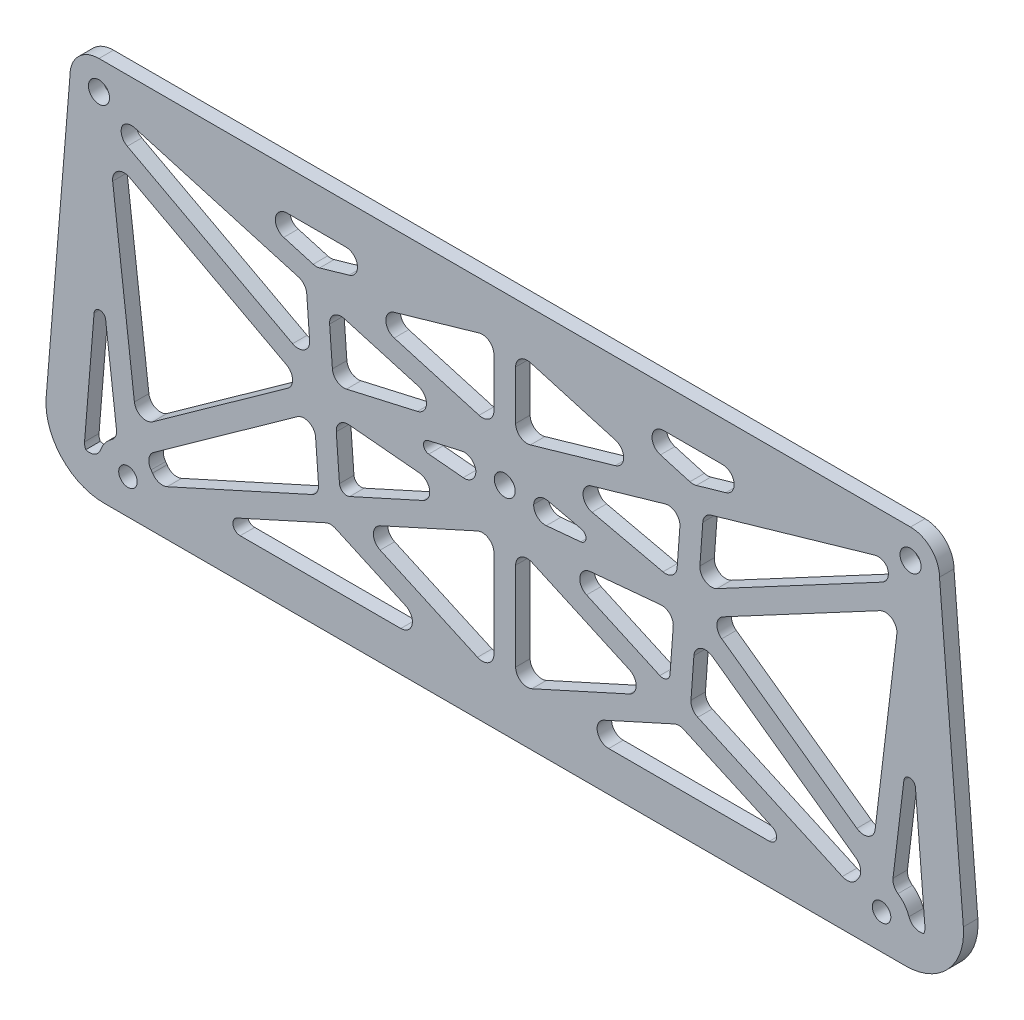
from build123d import *

# Parameters (mm, degrees)
SKETCH1_R              = 2.286
SKETCH1_R_2            = 2.3114
SKETCH1_R_3            = 2.032
BOSS_EXTRUDE1_DEPTH    = 3.175
FILLET1_R              = 12.7
CUT_EXTRUDE2_REACH     = 144.71
FILLET3_R              = 1.27
FILLET3_R_2            = 2.54
FILLET3_R_3            = 1.5875
FILLET3_OF_MIRROR1_R   = 1.27
FILLET3_OF_MIRROR1_R_2 = 2.54
FILLET3_OF_MIRROR1_R_3 = 1.5875


with BuildPart() as part:
    # Sketch1 → Boss-Extrude1 (new body)
    with BuildSketch(Plane.XY):
        with BuildLine():
            Line((-87.251790909, 0.809045632), (115.948209091, 0.809045632))
            Line((115.948209091, 0.809045632), (109.598209091, 78.279045632))
            ThreePointArc((109.598209091, 78.279045632), (107.738337152, 82.769173692), (103.248209091, 84.629045632))
            Line((103.248209091, 84.629045632), (-74.551790909, 84.629045632))
            ThreePointArc((-74.551790909, 84.629045632), (-79.041918969, 82.769173692), (-80.901790909, 78.279045632))
            Line((-80.901790909, 78.279045632), (-87.251790909, 0.809045632))
        make_face()
        with Locations((14.348209091, 48.116545632)):
            Circle(SKETCH1_R, mode=Mode.SUBTRACT)
        with Locations((-74.551790909, 78.279045632)):
            Circle(SKETCH1_R_2, mode=Mode.SUBTRACT)
        with Locations((103.248209091, 78.279045632)):
            Circle(SKETCH1_R_2, mode=Mode.SUBTRACT)
        with Locations((96.898209091, 8.429045632)):
            Circle(SKETCH1_R_3, mode=Mode.SUBTRACT)
        with Locations((-68.201790909, 8.455715632)):
            Circle(SKETCH1_R_3, mode=Mode.SUBTRACT)
    extrude(amount=BOSS_EXTRUDE1_DEPTH)

    # Fillet1
    fillet1_edges = [part.edges().sort_by_distance(p)[0] for p in [
        (115.948209091, 0.809045632, 1.5875),
        (-87.251790909, 0.809045632, 1.5875),
    ]]
    fillet(fillet1_edges, radius=FILLET1_R)

    # Sketch5 → Cut-Extrude2 (cut, up to next)
    with BuildSketch(Plane.XY.offset(3.175), mode=Mode.PRIVATE) as cut_extrude2_sk1:
        Polygon((-66.28077979, 19.080513036), (-29.871612483, 45.123700543), (-72.138211643, 67.69608706), align=None)
    cut_extrude2_tool1 = extrude(cut_extrude2_sk1.sketch, amount=-CUT_EXTRUDE2_REACH, mode=Mode.PRIVATE) & part.part
    # Sketch5 → Cut-Extrude2 (cut, up to next)
    with BuildSketch(Plane.XY.offset(3.175), mode=Mode.PRIVATE) as cut_extrude2_sk2:
        with BuildLine():
            ThreePointArc((-65.157616813, 14.028462178), (-63.107706759, 12.246864096), (-61.98966106, 9.771748589))
            Line((-61.98966106, 9.771748589), (-26.31599147, 25.945141322))
            Line((-26.31599147, 25.945141322), (-27.429755729, 41.014900846))
            Line((-27.429755729, 41.014900846), (-65.157616813, 14.028462178))
        make_face()
    cut_extrude2_tool2 = extrude(cut_extrude2_sk2.sketch, amount=-CUT_EXTRUDE2_REACH, mode=Mode.PRIVATE) & part.part
    # Sketch5 → Cut-Extrude2 (cut, up to next)
    with BuildSketch(Plane.XY.offset(3.175), mode=Mode.PRIVATE) as cut_extrude2_sk3:
        Polygon((-21.695328384, 28.040014084), (5.168325584, 40.219204811), (-22.785394449, 42.78912579), align=None)
    cut_extrude2_tool3 = extrude(cut_extrude2_sk3.sketch, amount=-CUT_EXTRUDE2_REACH, mode=Mode.PRIVATE) & part.part
    # Sketch5 → Cut-Extrude2 (cut, up to next)
    with BuildSketch(Plane.XY.offset(3.175), mode=Mode.PRIVATE) as cut_extrude2_sk4:
        with BuildLine():
            Line((-29.16875322, 64.544363036), (-68.630737441, 75.930565083))
            ThreePointArc((-68.630737441, 75.930565083), (-69.762627421, 74.085009525), (-71.448753582, 72.726985662))
            Line((-71.448753582, 72.726985662), (-28.06099333, 49.555845472))
            Line((-28.06099333, 49.555845472), (-29.16875322, 64.544363036))
        make_face()
    cut_extrude2_tool4 = extrude(cut_extrude2_sk4.sketch, amount=-CUT_EXTRUDE2_REACH, mode=Mode.PRIVATE) & part.part
    # Sketch5 → Cut-Extrude2 (cut, up to next)
    with BuildSketch(Plane.XY.offset(3.175), mode=Mode.PRIVATE) as cut_extrude2_sk5:
        Polygon((-23.196725961, 48.354636552), (4.818951722, 54.737687493), (-24.289208089, 63.13643873), align=None)
    cut_extrude2_tool5 = extrude(cut_extrude2_sk5.sketch, amount=-CUT_EXTRUDE2_REACH, mode=Mode.PRIVATE) & part.part
    # Sketch5 → Cut-Extrude2 (cut, up to next)
    with BuildSketch(Plane.XY.offset(3.175), mode=Mode.PRIVATE) as cut_extrude2_sk6:
        Polygon((11.966959091, 75.11357765), (-18.326601544, 66.372795632), (11.966959091, 57.632013613), align=None)
    cut_extrude2_tool6 = extrude(cut_extrude2_sk6.sketch, amount=-CUT_EXTRUDE2_REACH, mode=Mode.PRIVATE) & part.part
    # Sketch5 → Cut-Extrude2 (cut, up to next)
    with BuildSketch(Plane.XY.offset(3.175), mode=Mode.PRIVATE) as cut_extrude2_sk7:
        Polygon((-26.916142948, 68.851187325), (-2.494202721, 75.897795632), (-51.338083176, 75.897795632), align=None)
    cut_extrude2_tool7 = extrude(cut_extrude2_sk7.sketch, amount=-CUT_EXTRUDE2_REACH, mode=Mode.PRIVATE) & part.part
    # Sketch5 → Cut-Extrude2 (cut, up to next)
    with BuildSketch(Plane.XY.offset(3.175), mode=Mode.PRIVATE) as cut_extrude2_sk8:
        Polygon((11.966959091, 10.853182764), (-18.051778519, 24.462795632), (11.966959091, 38.0724085), align=None)
    cut_extrude2_tool8 = extrude(cut_extrude2_sk8.sketch, amount=-CUT_EXTRUDE2_REACH, mode=Mode.PRIVATE) & part.part
    # Sketch5 → Cut-Extrude2 (cut, up to next)
    with BuildSketch(Plane.XY.offset(3.175), mode=Mode.PRIVATE) as cut_extrude2_sk9:
        Polygon((3.328971218, 9.540295632), (-50.966352676, 9.540295632), (-23.818690729, 21.848247224), align=None)
    cut_extrude2_tool9 = extrude(cut_extrude2_sk9.sketch, amount=-CUT_EXTRUDE2_REACH, mode=Mode.PRIVATE) & part.part
    # Sketch5 → Cut-Extrude2 (cut, up to next)
    with BuildSketch(Plane.XY.offset(3.175), mode=Mode.PRIVATE) as cut_extrude2_sk10:
        with BuildLine():
            Line((-74.5984224, 48.301652359), (-77.828650702, 8.892867072))
            ThreePointArc((-77.828650702, 8.892867072), (-76.257166964, 7.804288888), (-74.432911183, 7.232751967))
            ThreePointArc((-74.432911183, 7.232751967), (-73.766936809, 11.513762576), (-70.510324917, 14.371218208))
            Line((-70.510324917, 14.371218208), (-74.5984224, 48.301652359))
        make_face()
    cut_extrude2_tool10 = extrude(cut_extrude2_sk10.sketch, amount=-CUT_EXTRUDE2_REACH, mode=Mode.PRIVATE) & part.part
    # Sketch5 → Cut-Extrude2 (cut, up to next)
    with BuildSketch(Plane.XY.offset(3.175), mode=Mode.PRIVATE) as cut_extrude2_sk11:
        with BuildLine():
            ThreePointArc((9.030021603, 44.646764393), (8.018160294, 47.613572252), (8.54880926, 50.702944982))
            Line((8.54880926, 50.702944982), (-10.251818791, 46.419437443))
            Line((-10.251818791, 46.419437443), (9.030021603, 44.646764393))
        make_face()
    cut_extrude2_tool11 = extrude(cut_extrude2_sk11.sketch, amount=-CUT_EXTRUDE2_REACH, mode=Mode.PRIVATE) & part.part
    cut_extrude2_1 = cut_extrude2_tool1.solids().sort_by_distance((-56.096868, 43.966767, 3.175))[0]
    add(cut_extrude2_1, mode=Mode.SUBTRACT)
    cut_extrude2_2 = cut_extrude2_tool2.solids().sort_by_distance((-42.444384, 24.422021, 3.175))[0]
    add(cut_extrude2_2, mode=Mode.SUBTRACT)
    cut_extrude2_3 = cut_extrude2_tool3.solids().sort_by_distance((-13.104132, 37.016115, 3.175))[0]
    add(cut_extrude2_3, mode=Mode.SUBTRACT)
    cut_extrude2_4 = cut_extrude2_tool4.solids().sort_by_distance((-45.564148, 64.027575, 3.175))[0]
    add(cut_extrude2_4, mode=Mode.SUBTRACT)
    cut_extrude2_5 = cut_extrude2_tool5.solids().sort_by_distance((-14.222327, 55.409588, 3.175))[0]
    add(cut_extrude2_5, mode=Mode.SUBTRACT)
    cut_extrude2_6 = cut_extrude2_tool6.solids().sort_by_distance((1.869106, 66.372796, 3.175))[0]
    add(cut_extrude2_6, mode=Mode.SUBTRACT)
    cut_extrude2_7 = cut_extrude2_tool7.solids().sort_by_distance((-26.916143, 73.548926, 3.175))[0]
    add(cut_extrude2_7, mode=Mode.SUBTRACT)
    cut_extrude2_8 = cut_extrude2_tool8.solids().sort_by_distance((1.960713, 24.462796, 3.175))[0]
    add(cut_extrude2_8, mode=Mode.SUBTRACT)
    cut_extrude2_9 = cut_extrude2_tool9.solids().sort_by_distance((-23.818691, 13.642946, 3.175))[0]
    add(cut_extrude2_9, mode=Mode.SUBTRACT)
    cut_extrude2_10 = cut_extrude2_tool10.solids().sort_by_distance((-74.391767, 23.038557, 3.175))[0]
    add(cut_extrude2_10, mode=Mode.SUBTRACT)
    cut_extrude2_11 = cut_extrude2_tool11.solids().sort_by_distance((2.092613, 47.233567, 3.175))[0]
    add(cut_extrude2_11, mode=Mode.SUBTRACT)
    cut_extrude2 = cut_extrude2_1 + cut_extrude2_2 + cut_extrude2_3 + cut_extrude2_4 + cut_extrude2_5 + cut_extrude2_6 + cut_extrude2_7 + cut_extrude2_8 + cut_extrude2_9 + cut_extrude2_10 + cut_extrude2_11  # Cut-Extrude2 as one shape, for the pattern or mirror that repeats it

    # Fillet3
    # the kernel refuses this fillet: 2.54, 1.5875, 1.27 mm, written as the material it adds along each edge
    with BuildSketch(Plane(origin=(-74.5984224, 48.301652359, 3.175), x_dir=(0.11961957547538542, -0.9928198009523624, 0), z_dir=(0, 0, -1))) as fillet3_piece_1:
        with BuildLine():
            CenterArc((FILLET3_R * 9.88251703181, FILLET3_R), FILLET3_R, 101.556047555, 168.443952445)
            Line((FILLET3_R * 9.6821906165, FILLET3_R * 1.97972921123), (0, 0))
            Line((0, 0), (FILLET3_R * 9.88251703181, 0))
        make_face()
    extrude(amount=3.175)
    with BuildSketch(Plane(origin=(-10.251818791, 46.419437443, 3.175), x_dir=(0.9750134933938565, 0.2221456452418279, 0), z_dir=(0, 0, -1))) as fillet3_piece_2:
        with BuildLine():
            CenterArc((FILLET3_R * 6.28259209384, FILLET3_R), FILLET3_R, 108.087801658, 161.912198342)
            Line((FILLET3_R * 5.97211803722, FILLET3_R * 1.95058185348), (0, 0))
            Line((0, 0), (FILLET3_R * 6.28259209384, 0))
        make_face()
    extrude(amount=3.175)
    with BuildSketch(Plane(origin=(-2.494202721, 75.897795632, 3.175), x_dir=(-1, 0, 0), z_dir=(0, 0, -1))) as fillet3_piece_3:
        with BuildLine():
            CenterArc((FILLET3_R_2 * 7.07292884489, -FILLET3_R_2), FILLET3_R_2, 90, 163.905246513)
            Line((FILLET3_R_2 * 6.79570217026, -FILLET3_R_2 * 1.96080454353), (0, 0))
            Line((0, 0), (FILLET3_R_2 * 7.07292884489, 0))
        make_face()
    extrude(amount=3.175)
    with BuildSketch(Plane(origin=(-51.338083176, 75.897795632, 3.175), x_dir=(1, 0, 0), z_dir=(0, 0, -1))) as fillet3_piece_4:
        with BuildLine():
            CenterArc((FILLET3_R_2 * 7.07292884489, FILLET3_R_2), FILLET3_R_2, 106.094753487, 163.905246513)
            Line((FILLET3_R_2 * 6.79570217026, FILLET3_R_2 * 1.96080454353), (0, 0))
            Line((0, 0), (FILLET3_R_2 * 7.07292884489, 0))
        make_face()
    extrude(amount=3.175)
    with BuildSketch(Plane(origin=(8.54880926, 50.702944982, 3.175), x_dir=(-0.9750134933938565, -0.22214564524182795, 0), z_dir=(0, 0, -1))) as fillet3_piece_5:
        with BuildLine():
            CenterArc((3.718869998, -2.54), FILLET3_R_2, 90, 98.213768649)
            ThreePointArc((1.204925503, -2.902881624), (0.784902966, -1.375713691), (0, 0))
            Line((0, 0), (3.718869998, 0))
        make_face()
    extrude(amount=3.175)
    with BuildSketch(Plane(origin=(9.030021603, 44.646764393, 3.175), x_dir=(-0.9958005933570363, 0.0915487753592294, 0), z_dir=(0, 0, -1))) as fillet3_piece_6:
        with BuildLine():
            CenterArc((3.80053912, 2.54), FILLET3_R_2, 170.925725398, 99.074274602)
            ThreePointArc((1.292327933, 2.940595362), (0.835167809, 1.387234588), (0, 0))
            Line((0, 0), (3.80053912, 0))
        make_face()
    extrude(amount=3.175)
    with BuildSketch(Plane(origin=(5.168325584, 40.219204811, 3.175), x_dir=(-0.9958005933570362, 0.09154877535923055, 0), z_dir=(0, 0, -1))) as fillet3_piece_7:
        with BuildLine():
            CenterArc((FILLET3_R_2 * 3.77939161606, -FILLET3_R_2), FILLET3_R_2, 90, 150.359144776)
            Line((FILLET3_R_2 * 3.28482987463, -FILLET3_R_2 * 1.8691424992), (0, 0))
            Line((0, 0), (FILLET3_R_2 * 3.77939161606, 0))
        make_face()
    extrude(amount=3.175)
    with BuildSketch(Plane(origin=(-22.785394449, 42.78912579, 3.175), x_dir=(0.9958005933570361, -0.09154877535923026, 0), z_dir=(0, 0, -1))) as fillet3_piece_8:
        with BuildLine():
            CenterArc((FILLET3_R_2 * 1.1808213888, FILLET3_R_2), FILLET3_R_2, 170.52039906, 99.47960094)
            Line((FILLET3_R_2 * 0.194477087751, FILLET3_R_2 * 1.1646964474), (0, 0))
            Line((0, 0), (FILLET3_R_2 * 1.1808213888, 0))
        make_face()
    extrude(amount=3.175)
    with BuildSketch(Plane(origin=(-24.289208089, 63.13643873, 3.175), x_dir=(0.9608045435341553, -0.2772266746258794, 0), z_dir=(0, 0, -1))) as fillet3_piece_9:
        with BuildLine():
            CenterArc((FILLET3_R_2 * 1.43671408313, FILLET3_R_2), FILLET3_R_2, 159.67835884, 110.32164116)
            Line((FILLET3_R_2 * 0.498956256307, FILLET3_R_2 * 1.34728987637), (0, 0))
            Line((0, 0), (FILLET3_R_2 * 1.43671408313, 0))
        make_face()
    extrude(amount=3.175)
    with BuildSketch(Plane(origin=(-68.630737441, 75.930565083, 3.175), x_dir=(0.9608045435341557, -0.2772266746258787, 0), z_dir=(0, 0, -1))) as fillet3_piece_10:
        with BuildLine():
            CenterArc((1.989519717, 2.54), FILLET3_R_2, 200.827301976, 69.172698024)
            ThreePointArc((-0.384507433, 1.636896967), (-0.137833822, 0.831231728), (0, 0))
            Line((0, 0), (1.989519717, 0))
        make_face()
    extrude(amount=3.175)
    with BuildSketch(Plane(origin=(-72.138211643, 67.69608706, 3.175), x_dir=(0.8820911004887111, -0.4710788579830499, 0), z_dir=(0, 0, -1))) as fillet3_piece_11:
        with BuildLine():
            CenterArc((FILLET3_R_2 * 1.91993879235, FILLET3_R_2), FILLET3_R_2, 145.025501931, 124.974498069)
            Line((FILLET3_R_2 * 1.10053153455, FILLET3_R_2 * 1.57321178099), (0, 0))
            Line((0, 0), (FILLET3_R_2 * 1.91993879235, 0))
        make_face()
    extrude(amount=3.175)
    with BuildSketch(Plane(origin=(-27.429755729, 41.014900846, 3.175), x_dir=(0.07370620720228421, -0.9972799983053175, 0), z_dir=(0, 0, -1))) as fillet3_piece_12:
        with BuildLine():
            CenterArc((FILLET3_R_2 * 1.78012041009, FILLET3_R_2), FILLET3_R_2, 148.651049013, 121.348950987)
            Line((FILLET3_R_2 * 0.926105745969, FILLET3_R_2 * 1.52024893413), (0, 0))
            Line((0, 0), (FILLET3_R_2 * 1.78012041009, 0))
        make_face()
    extrude(amount=3.175)
    with BuildSketch(Plane(origin=(-29.16875322, 64.544363036, 3.175), x_dir=(0.07370620720228492, -0.9972799983053174, 0), z_dir=(0, 0, -1))) as fillet3_piece_13:
        with BuildLine():
            CenterArc((FILLET3_R_2 * 0.696032712243, FILLET3_R_2), FILLET3_R_2, 200.32164116, 69.67835884)
            Line((-FILLET3_R_2 * 0.241725114583, FILLET3_R_2 * 0.652710123632), (0, 0))
            Line((0, 0), (FILLET3_R_2 * 0.696032712243, 0))
        make_face()
    extrude(amount=3.175)
    with BuildSketch(Plane(origin=(11.966959091, 75.11357765, 3.175), x_dir=(0, -1, 0), z_dir=(0, 0, -1)), Plane(origin=(11.966959091, 57.632013613, 3.175), x_dir=(-0.9608045435341552, 0.27722667462588046, 0), z_dir=(0, 0, -1))) as fillet3_piece_14:
        with BuildLine():
            CenterArc((FILLET3_R_2 * 1.32933038589, FILLET3_R_2), FILLET3_R_2, 163.905246513, 106.094753487)
            Line((FILLET3_R_2 * 0.368525842361, FILLET3_R_2 * 1.27722667463), (0, 0))
            Line((0, 0), (FILLET3_R_2 * 1.32933038589, 0))
        make_face()
    extrude(amount=3.175)
    with BuildSketch(Plane(origin=(11.966959091, 38.0724085, 3.175), x_dir=(0, -1, 0), z_dir=(0, 0, -1)), Plane(origin=(11.966959091, 10.853182764, 3.175), x_dir=(-0.910769138180063, 0.41291594415661065, 0), z_dir=(0, 0, -1))) as fillet3_piece_15:
        with BuildLine():
            CenterArc((FILLET3_R_2 * 1.55134367748, FILLET3_R_2), FILLET3_R_2, 155.611858043, 114.388141957)
            Line((FILLET3_R_2 * 0.640574539297, FILLET3_R_2 * 1.41291594416), (0, 0))
            Line((0, 0), (FILLET3_R_2 * 1.55134367748, 0))
        make_face()
    extrude(amount=3.175)
    with BuildSketch(Plane(origin=(-23.818690729, 21.848247224, 3.175), x_dir=(0.9107691381800633, -0.41291594415661004, 0), z_dir=(0, 0, -1))) as fillet3_piece_16:
        with BuildLine():
            CenterArc((FILLET3_R_2 * 0.453370592883, FILLET3_R_2), FILLET3_R_2, 221.223716087, 48.776283913)
            Line((-FILLET3_R_2 * 0.298771604317, FILLET3_R_2 * 0.340999153877), (0, 0))
            Line((0, 0), (FILLET3_R_2 * 0.453370592883, 0))
        make_face()
    extrude(amount=3.175)
    with BuildSketch(Plane(origin=(3.328971218, 9.540295632, 3.175), x_dir=(-1, 0, 0), z_dir=(0, 0, -1))) as fillet3_piece_17:
        with BuildLine():
            CenterArc((FILLET3_R_2 * 4.62750146905, FILLET3_R_2), FILLET3_R_2, 114.388141957, 155.611858043)
            Line((FILLET3_R_2 * 4.2145855249, FILLET3_R_2 * 1.91076913818), (0, 0))
            Line((0, 0), (FILLET3_R_2 * 4.62750146905, 0))
        make_face()
    extrude(amount=3.175)
    with BuildSketch(Plane(origin=(4.818951722, 54.737687493, 3.175), x_dir=(-0.9608045435341558, 0.27722667462587847, 0), z_dir=(0, 0, -1))) as fillet3_piece_18:
        with BuildLine():
            CenterArc((FILLET3_R_2 * 3.87650248104, -FILLET3_R_2), FILLET3_R_2, 90, 151.070158123)
            Line((FILLET3_R_2 * 3.39276418727, -FILLET3_R_2 * 1.87521269595), (0, 0))
            Line((0, 0), (FILLET3_R_2 * 3.87650248104, 0))
        make_face()
    extrude(amount=3.175)
    with BuildSketch(Plane(origin=(-26.31599147, 25.945141322, 3.175), x_dir=(-0.07370620720228446, 0.9972799983053174, 0), z_dir=(0, 0, -1))) as fillet3_piece_19:
        with BuildLine():
            CenterArc((FILLET3_R_2 * 0.698112450716, -FILLET3_R_2), FILLET3_R_2, 90, 69.838745716)
            Line((-FILLET3_R_2 * 0.240613862002, -FILLET3_R_2 * 0.655336526723), (0, 0))
            Line((0, 0), (FILLET3_R_2 * 0.698112450716, 0))
        make_face()
    extrude(amount=3.175)
    with BuildSketch(Plane(origin=(-28.06099333, 49.555845472, 3.175), x_dir=(-0.07370620720228409, 0.9972799983053175, 0), z_dir=(0, 0, -1))) as fillet3_piece_20:
        with BuildLine():
            CenterArc((FILLET3_R_2 * 1.81641055948, -FILLET3_R_2), FILLET3_R_2, 90, 122.331238026)
            Line((FILLET3_R_2 * 0.971440184193, -FILLET3_R_2 * 1.53481311211), (0, 0))
            Line((0, 0), (FILLET3_R_2 * 1.81641055948, 0))
        make_face()
    extrude(amount=3.175)
    with BuildSketch(Plane(origin=(-23.196725961, 48.354636552, 3.175), x_dir=(-0.0737062072022844, 0.9972799983053174, 0), z_dir=(0, 0, -1))) as fillet3_piece_21:
        with BuildLine():
            CenterArc((FILLET3_R_2 * 1.16277556611, FILLET3_R_2), FILLET3_R_2, 171.391799282, 98.608200718)
            Line((FILLET3_R_2 * 0.174040598109, FILLET3_R_2 * 1.14967686214), (0, 0))
            Line((0, 0), (FILLET3_R_2 * 1.16277556611, 0))
        make_face()
    extrude(amount=3.175)
    with BuildSketch(Plane(origin=(-61.98966106, 9.771748589, 3.175), x_dir=(-0.37407857866683897, 0.9273970115234346, 0), z_dir=(0, 0, -1))) as fillet3_piece_22:
        with BuildLine():
            CenterArc((2.648015214, 2.501364158), FILLET3_R_2, 177.579232865, 82.414594131)
            Line((0.110281944, 2.608648139), (0, 0))
            ThreePointArc((0, 0), (1.103339672, 0.096589605), (2.206679345, 0))
        make_face()
    extrude(amount=3.175)
    with BuildSketch(Plane(origin=(-66.28077979, 19.080513036, 3.175), x_dir=(-0.11961957547536928, 0.9928198009523644, 0), z_dir=(0, 0, -1))) as fillet3_piece_23:
        with BuildLine():
            CenterArc((FILLET3_R_2 * 1.68773596618, FILLET3_R_2), FILLET3_R_2, 151.294309056, 118.705690944)
            Line((FILLET3_R_2 * 0.810637505343, FILLET3_R_2 * 1.48031061824), (0, 0))
            Line((0, 0), (FILLET3_R_2 * 1.68773596618, 0))
        make_face()
    extrude(amount=3.175)
    with BuildSketch(Plane(origin=(-77.828650702, 8.892867072, 3.175), x_dir=(0.0816932394462296, 0.9966575212322341, 0), z_dir=(0, 0, -1))) as fillet3_piece_24:
        with BuildLine():
            CenterArc((1.425002632, 2.54), FILLET3_R_2, 202.024312837, 67.975687163)
            ThreePointArc((-0.929640388, 1.5875), (-0.522614683, 0.759905533), (0, 0))
            Line((0, 0), (1.425002632, 0))
        make_face()
    extrude(amount=3.175)
    with BuildSketch(Plane(origin=(-70.510324917, 14.371218208, 3.175), x_dir=(-0.11961957547538414, 0.9928198009523626, 0), z_dir=(0, 0, -1))) as fillet3_piece_25:
        with BuildLine():
            CenterArc((1.726221314, -2.54), FILLET3_R_2, 90, 62.358926942)
            ThreePointArc((-0.523891618, -1.361614752), (-0.222711779, -0.695902967), (0, 0))
            Line((0, 0), (1.726221314, 0))
        make_face()
    extrude(amount=3.175)
    with BuildSketch(Plane(origin=(-74.432911183, 7.232751967, 3.175), x_dir=(-0.8470296008404652, 0.5315457226806006, 0), z_dir=(0, 0, -1))) as fillet3_piece_26:
        with BuildLine():
            CenterArc((4.030417948, 2.331594561), FILLET3_R_2, 166.890159603, 126.481549299)
            ThreePointArc((1.556617902, 2.907713759), (0.97038562, 1.351030396), (0, 0))
            ThreePointArc((0, 0), (2.519011218, -0.521013597), (5.038022436, 0))
        make_face()
    extrude(amount=3.175)
    with BuildSketch(Plane(origin=(-29.871612483, 45.123700543, 3.175), x_dir=(-0.8820911004887108, 0.47107885798305055, 0), z_dir=(0, 0, -1))) as fillet3_piece_27:
        with BuildLine():
            CenterArc((FILLET3_R_2 * 1.61031765427, -FILLET3_R_2), FILLET3_R_2, 90, 116.319810987)
            Line((FILLET3_R_2 * 0.713984476843, -FILLET3_R_2 * 1.44338113971), (0, 0))
            Line((0, 0), (FILLET3_R_2 * 1.61031765427, 0))
        make_face()
    extrude(amount=3.175)
    with BuildSketch(Plane(origin=(-71.448753582, 72.726985662, 3.175), x_dir=(0.7367969522101028, 0.6761140815083675, 0), z_dir=(0, 0, -1))) as fillet3_piece_28:
        with BuildLine():
            CenterArc((3.559699804, 2.46973985), FILLET3_R_2, 160.64507525, 95.847220994)
            Line((1.163251254, 3.311544072), (0, 0))
            ThreePointArc((0, 0), (1.483208252, 0.175650376), (2.966416503, 0))
        make_face()
    extrude(amount=3.175)
    with BuildSketch(Plane(origin=(-26.916142948, 68.851187325, 3.175), x_dir=(-0.960804543534154, 0.27722667462588385, 0), z_dir=(0, 0, -1))) as fillet3_piece_29:
        with BuildLine():
            CenterArc((FILLET3_R_2 * 0.288535973827, FILLET3_R_2), FILLET3_R_2, 237.810493026, 32.189506974)
            Line((-FILLET3_R_2 * 0.244185323312, FILLET3_R_2 * 0.153709258248), (0, 0))
            Line((0, 0), (FILLET3_R_2 * 0.288535973827, 0))
        make_face()
    extrude(amount=3.175)
    with BuildSketch(Plane(origin=(-18.326601544, 66.372795632, 3.175), x_dir=(0.9608045435341556, -0.2772266746258786, 0), z_dir=(0, 0, -1))) as fillet3_piece_30:
        with BuildLine():
            CenterArc((FILLET3_R_2 * 3.46577234976, -FILLET3_R_2), FILLET3_R_2, 90, 147.810493026)
            Line((FILLET3_R_2 * 2.93305105262, -FILLET3_R_2 * 1.84629074175), (0, 0))
            Line((0, 0), (FILLET3_R_2 * 3.46577234976, 0))
        make_face()
    extrude(amount=3.175)
    with BuildSketch(Plane(origin=(-18.051778519, 24.462795632, 3.175), x_dir=(0.910769138180063, -0.4129159441566107, 0), z_dir=(0, 0, -1))) as fillet3_piece_31:
        with BuildLine():
            CenterArc((FILLET3_R_2 * 2.20570106596, -FILLET3_R_2), FILLET3_R_2, 90, 131.223716087)
            Line((FILLET3_R_2 * 1.45355886876, -FILLET3_R_2 * 1.65900084612), (0, 0))
            Line((0, 0), (FILLET3_R_2 * 2.20570106596, 0))
        make_face()
    extrude(amount=3.175)
    with BuildSketch(Plane(origin=(-65.157616813, 14.028462178, 3.175), x_dir=(0.813346167055302, 0.5817800379322488, 0), z_dir=(0, 0, -1))) as fillet3_piece_32:
        with BuildLine():
            CenterArc((3.169159329, 2.54), FILLET3_R_2, 178.572083111, 91.427916889)
            ThreePointArc((0.629948084, 2.603294949), (0.453793882, 1.268055702), (0, 0))
            Line((0, 0), (3.169159329, 0))
        make_face()
    extrude(amount=3.175)
    with BuildSketch(Plane(origin=(-21.695328384, 28.040014084, 3.175), x_dir=(-0.07370620720228395, 0.9972799983053173, 0), z_dir=(0, 0, -1))) as fillet3_piece_33:
        with BuildLine():
            CenterArc((FILLET3_R_3 * 1.43243398535, FILLET3_R_3), FILLET3_R_3, 159.838745716, 110.161254284)
            Line((FILLET3_R_3 * 0.493707672629, FILLET3_R_3 * 1.34466347328), (0, 0))
            Line((0, 0), (FILLET3_R_3 * 1.43243398535, 0))
        make_face()
    extrude(amount=3.175)
    with BuildSketch(Plane(origin=(-50.966352676, 9.540295632, 3.175), x_dir=(1, 0, 0), z_dir=(0, 0, -1))) as fillet3_piece_34:
        with BuildLine():
            CenterArc((FILLET3_R_3 * 4.62750146905, -FILLET3_R_3), FILLET3_R_3, 90, 155.611858043)
            Line((FILLET3_R_3 * 4.2145855249, -FILLET3_R_3 * 1.91076913818), (0, 0))
            Line((0, 0), (FILLET3_R_3 * 4.62750146905, 0))
        make_face()
    extrude(amount=3.175)

    # Mirror1: Cut-Extrude2 across plane
    add(cut_extrude2.mirror(Plane(origin=(14.348209091, 0, 0), x_dir=(0, 0, 1), z_dir=(1, 0, 0))), mode=Mode.SUBTRACT)

    # Fillet3 of Mirror1
    # the kernel refuses this fillet: 2.54, 1.5875, 1.27 mm, written as the material it adds along each edge
    with BuildSketch(Plane(origin=(103.294840582, 48.301652359, 3.175), x_dir=(0.08169323944622847, -0.9966575212322341, 0), z_dir=(0, 0, -1))) as fillet3_of_mirror1_piece_1:
        with BuildLine():
            CenterArc((FILLET3_OF_MIRROR1_R * 9.88251703181, FILLET3_OF_MIRROR1_R), FILLET3_OF_MIRROR1_R, 101.556047555, 168.443952445)
            Line((FILLET3_OF_MIRROR1_R * 9.6821906165, FILLET3_OF_MIRROR1_R * 1.97972921123), (0, 0))
            Line((0, 0), (FILLET3_OF_MIRROR1_R * 9.88251703181, 0))
        make_face()
    extrude(amount=3.175)
    with BuildSketch(Plane(origin=(38.948236973, 46.419437443, 3.175), x_dir=(-0.9958005933570363, -0.09154877535922887, 0), z_dir=(0, 0, -1))) as fillet3_of_mirror1_piece_2:
        with BuildLine():
            CenterArc((FILLET3_OF_MIRROR1_R * 6.28259209384, FILLET3_OF_MIRROR1_R), FILLET3_OF_MIRROR1_R, 108.087801658, 161.912198342)
            Line((FILLET3_OF_MIRROR1_R * 5.97211803722, FILLET3_OF_MIRROR1_R * 1.95058185348), (0, 0))
            Line((0, 0), (FILLET3_OF_MIRROR1_R * 6.28259209384, 0))
        make_face()
    extrude(amount=3.175)
    with BuildSketch(Plane(origin=(31.190620903, 75.897795632, 3.175), x_dir=(1, 0, 0), z_dir=(0, 0, -1)), Plane(origin=(80.034501358, 75.897795632, 3.175), x_dir=(-0.9608045435341557, -0.27722667462587897, 0), z_dir=(0, 0, -1))) as fillet3_of_mirror1_piece_3:
        with BuildLine():
            CenterArc((FILLET3_OF_MIRROR1_R_2 * 7.07292884489, FILLET3_OF_MIRROR1_R_2), FILLET3_OF_MIRROR1_R_2, 106.094753487, 163.905246513)
            Line((FILLET3_OF_MIRROR1_R_2 * 6.79570217026, FILLET3_OF_MIRROR1_R_2 * 1.96080454353), (0, 0))
            Line((0, 0), (FILLET3_OF_MIRROR1_R_2 * 7.07292884489, 0))
        make_face()
    extrude(amount=3.175)
    with BuildSketch(Plane(origin=(20.147608922, 50.702944982, 3.175), x_dir=(0.9750134933938567, -0.22214564524182764, 0), z_dir=(0, 0, -1))) as fillet3_of_mirror1_piece_4:
        with BuildLine():
            CenterArc((3.718869998, 2.54), FILLET3_OF_MIRROR1_R_2, 171.786231351, 98.213768649)
            ThreePointArc((1.204925503, 2.902881624), (0.784902966, 1.375713691), (0, 0))
            Line((0, 0), (3.718869998, 0))
        make_face()
    extrude(amount=3.175)
    with BuildSketch(Plane(origin=(19.666396579, 44.646764393, 3.175), x_dir=(0.9958005933570363, 0.0915487753592294, 0), z_dir=(0, 0, -1))) as fillet3_of_mirror1_piece_5:
        with BuildLine():
            CenterArc((3.80053912, -2.54), FILLET3_OF_MIRROR1_R_2, 90, 99.074274602)
            ThreePointArc((1.292327933, -2.940595362), (0.835167809, -1.387234588), (0, 0))
            Line((0, 0), (3.80053912, 0))
        make_face()
    extrude(amount=3.175)
    with BuildSketch(Plane(origin=(23.528092598, 40.219204811, 3.175), x_dir=(0.9958005933570362, 0.09154877535923055, 0), z_dir=(0, 0, -1))) as fillet3_of_mirror1_piece_6:
        with BuildLine():
            CenterArc((FILLET3_OF_MIRROR1_R_2 * 3.77939161606, FILLET3_OF_MIRROR1_R_2), FILLET3_OF_MIRROR1_R_2, 119.640855224, 150.359144776)
            Line((FILLET3_OF_MIRROR1_R_2 * 3.28482987463, FILLET3_OF_MIRROR1_R_2 * 1.8691424992), (0, 0))
            Line((0, 0), (FILLET3_OF_MIRROR1_R_2 * 3.77939161606, 0))
        make_face()
    extrude(amount=3.175)
    with BuildSketch(Plane(origin=(51.481812632, 42.78912579, 3.175), x_dir=(-0.07370620720228421, -0.9972799983053174, 0), z_dir=(0, 0, -1))) as fillet3_of_mirror1_piece_7:
        with BuildLine():
            CenterArc((FILLET3_OF_MIRROR1_R_2 * 1.1808213888, FILLET3_OF_MIRROR1_R_2), FILLET3_OF_MIRROR1_R_2, 170.52039906, 99.47960094)
            Line((FILLET3_OF_MIRROR1_R_2 * 0.194477087751, FILLET3_OF_MIRROR1_R_2 * 1.1646964474), (0, 0))
            Line((0, 0), (FILLET3_OF_MIRROR1_R_2 * 1.1808213888, 0))
        make_face()
    extrude(amount=3.175)
    with BuildSketch(Plane(origin=(52.985626271, 63.13643873, 3.175), x_dir=(-0.07370620720228384, -0.9972799983053174, 0), z_dir=(0, 0, -1))) as fillet3_of_mirror1_piece_8:
        with BuildLine():
            CenterArc((FILLET3_OF_MIRROR1_R_2 * 1.43671408313, FILLET3_OF_MIRROR1_R_2), FILLET3_OF_MIRROR1_R_2, 159.67835884, 110.32164116)
            Line((FILLET3_OF_MIRROR1_R_2 * 0.498956256307, FILLET3_OF_MIRROR1_R_2 * 1.34728987637), (0, 0))
            Line((0, 0), (FILLET3_OF_MIRROR1_R_2 * 1.43671408313, 0))
        make_face()
    extrude(amount=3.175)
    with BuildSketch(Plane(origin=(97.327155623, 75.930565083, 3.175), x_dir=(0.4895937886440755, -0.8719506420211756, 0), z_dir=(0, 0, -1))) as fillet3_of_mirror1_piece_9:
        with BuildLine():
            CenterArc((2.017741265, 2.517639548), FILLET3_OF_MIRROR1_R_2, 193.219132492, 69.172698024)
            Line((-0.454955331, 1.93680261), (0, 0))
            ThreePointArc((0, 0), (0.840725527, 0.05590113), (1.681451054, 0))
        make_face()
    extrude(amount=3.175)
    with BuildSketch(Plane(origin=(100.834629825, 67.69608706, 3.175), x_dir=(-0.1196195754753685, -0.9928198009523646, 0), z_dir=(0, 0, -1))) as fillet3_of_mirror1_piece_10:
        with BuildLine():
            CenterArc((FILLET3_OF_MIRROR1_R_2 * 1.91993879235, FILLET3_OF_MIRROR1_R_2), FILLET3_OF_MIRROR1_R_2, 145.025501931, 124.974498069)
            Line((FILLET3_OF_MIRROR1_R_2 * 1.10053153455, FILLET3_OF_MIRROR1_R_2 * 1.57321178099), (0, 0))
            Line((0, 0), (FILLET3_OF_MIRROR1_R_2 * 1.91993879235, 0))
        make_face()
    extrude(amount=3.175)
    with BuildSketch(Plane(origin=(56.126173911, 41.014900846, 3.175), x_dir=(0.8133461670553023, -0.5817800379322484, 0), z_dir=(0, 0, -1))) as fillet3_of_mirror1_piece_11:
        with BuildLine():
            CenterArc((FILLET3_OF_MIRROR1_R_2 * 1.78012041009, FILLET3_OF_MIRROR1_R_2), FILLET3_OF_MIRROR1_R_2, 148.651049013, 121.348950987)
            Line((FILLET3_OF_MIRROR1_R_2 * 0.926105745969, FILLET3_OF_MIRROR1_R_2 * 1.52024893413), (0, 0))
            Line((0, 0), (FILLET3_OF_MIRROR1_R_2 * 1.78012041009, 0))
        make_face()
    extrude(amount=3.175)
    with BuildSketch(Plane(origin=(57.865171402, 64.544363036, 3.175), x_dir=(0.960804543534156, 0.27722667462587747, 0), z_dir=(0, 0, -1))) as fillet3_of_mirror1_piece_12:
        with BuildLine():
            CenterArc((FILLET3_OF_MIRROR1_R_2 * 0.696032712243, FILLET3_OF_MIRROR1_R_2), FILLET3_OF_MIRROR1_R_2, 200.32164116, 69.67835884)
            Line((-FILLET3_OF_MIRROR1_R_2 * 0.241725114583, FILLET3_OF_MIRROR1_R_2 * 0.652710123632), (0, 0))
            Line((0, 0), (FILLET3_OF_MIRROR1_R_2 * 0.696032712243, 0))
        make_face()
    extrude(amount=3.175)
    with BuildSketch(Plane(origin=(16.729459091, 75.11357765, 3.175), x_dir=(0, -1, 0), z_dir=(0, 0, -1))) as fillet3_of_mirror1_piece_13:
        with BuildLine():
            CenterArc((FILLET3_OF_MIRROR1_R_2 * 1.32933038589, -FILLET3_OF_MIRROR1_R_2), FILLET3_OF_MIRROR1_R_2, 90, 106.094753487)
            Line((FILLET3_OF_MIRROR1_R_2 * 0.368525842361, -FILLET3_OF_MIRROR1_R_2 * 1.27722667463), (0, 0))
            Line((0, 0), (FILLET3_OF_MIRROR1_R_2 * 1.32933038589, 0))
        make_face()
    extrude(amount=3.175)
    with BuildSketch(Plane(origin=(16.729459091, 38.0724085, 3.175), x_dir=(0.9107691381800634, -0.41291594415660987, 0), z_dir=(0, 0, -1))) as fillet3_of_mirror1_piece_14:
        with BuildLine():
            CenterArc((FILLET3_OF_MIRROR1_R_2 * 1.55134367748, FILLET3_OF_MIRROR1_R_2), FILLET3_OF_MIRROR1_R_2, 155.611858043, 114.388141957)
            Line((FILLET3_OF_MIRROR1_R_2 * 0.640574539297, FILLET3_OF_MIRROR1_R_2 * 1.41291594416), (0, 0))
            Line((0, 0), (FILLET3_OF_MIRROR1_R_2 * 1.55134367748, 0))
        make_face()
    extrude(amount=3.175)
    with BuildSketch(Plane(origin=(52.515108911, 21.848247224, 3.175), x_dir=(0.9107691381800638, -0.41291594415660915, 0), z_dir=(0, 0, -1))) as fillet3_of_mirror1_piece_15:
        with BuildLine():
            CenterArc((FILLET3_OF_MIRROR1_R_2 * 0.453370592883, FILLET3_OF_MIRROR1_R_2), FILLET3_OF_MIRROR1_R_2, 221.223716087, 48.776283913)
            Line((-FILLET3_OF_MIRROR1_R_2 * 0.298771604317, FILLET3_OF_MIRROR1_R_2 * 0.340999153877), (0, 0))
            Line((0, 0), (FILLET3_OF_MIRROR1_R_2 * 0.453370592883, 0))
        make_face()
    extrude(amount=3.175)
    with BuildSketch(Plane(origin=(25.367446964, 9.540295632, 3.175), x_dir=(1, 0, 0), z_dir=(0, 0, -1))) as fillet3_of_mirror1_piece_16:
        with BuildLine():
            CenterArc((FILLET3_OF_MIRROR1_R_2 * 4.62750146905, -FILLET3_OF_MIRROR1_R_2), FILLET3_OF_MIRROR1_R_2, 90, 155.611858043)
            Line((FILLET3_OF_MIRROR1_R_2 * 4.2145855249, -FILLET3_OF_MIRROR1_R_2 * 1.91076913818), (0, 0))
            Line((0, 0), (FILLET3_OF_MIRROR1_R_2 * 4.62750146905, 0))
        make_face()
    extrude(amount=3.175)
    with BuildSketch(Plane(origin=(23.87746646, 54.737687493, 3.175), x_dir=(0.9608045435341558, 0.27722667462587836, 0), z_dir=(0, 0, -1))) as fillet3_of_mirror1_piece_17:
        with BuildLine():
            CenterArc((FILLET3_OF_MIRROR1_R_2 * 3.87650248104, FILLET3_OF_MIRROR1_R_2), FILLET3_OF_MIRROR1_R_2, 118.929841877, 151.070158123)
            Line((FILLET3_OF_MIRROR1_R_2 * 3.39276418727, FILLET3_OF_MIRROR1_R_2 * 1.87521269595), (0, 0))
            Line((0, 0), (FILLET3_OF_MIRROR1_R_2 * 3.87650248104, 0))
        make_face()
    extrude(amount=3.175)
    with BuildSketch(Plane(origin=(55.012409652, 25.945141322, 3.175), x_dir=(0.07370620720228462, 0.9972799983053173, 0), z_dir=(0, 0, -1))) as fillet3_of_mirror1_piece_18:
        with BuildLine():
            CenterArc((FILLET3_OF_MIRROR1_R_2 * 0.698112450716, FILLET3_OF_MIRROR1_R_2), FILLET3_OF_MIRROR1_R_2, 200.161254284, 69.838745716)
            Line((-FILLET3_OF_MIRROR1_R_2 * 0.240613862002, FILLET3_OF_MIRROR1_R_2 * 0.655336526723), (0, 0))
            Line((0, 0), (FILLET3_OF_MIRROR1_R_2 * 0.698112450716, 0))
        make_face()
    extrude(amount=3.175)
    with BuildSketch(Plane(origin=(56.757411512, 49.555845472, 3.175), x_dir=(0.0737062072022832, 0.9972799983053175, 0), z_dir=(0, 0, -1))) as fillet3_of_mirror1_piece_19:
        with BuildLine():
            CenterArc((FILLET3_OF_MIRROR1_R_2 * 1.81641055948, FILLET3_OF_MIRROR1_R_2), FILLET3_OF_MIRROR1_R_2, 147.668761974, 122.331238026)
            Line((FILLET3_OF_MIRROR1_R_2 * 0.971440184193, FILLET3_OF_MIRROR1_R_2 * 1.53481311211), (0, 0))
            Line((0, 0), (FILLET3_OF_MIRROR1_R_2 * 1.81641055948, 0))
        make_face()
    extrude(amount=3.175)
    with BuildSketch(Plane(origin=(16.729459091, 10.853182764, 3.175), x_dir=(0.910769138180063, 0.41291594415661065, 0), z_dir=(0, 0, -1))) as fillet3_of_mirror1_piece_20:
        with BuildLine():
            CenterArc((FILLET3_OF_MIRROR1_R_2 * 1.55134367748, -FILLET3_OF_MIRROR1_R_2), FILLET3_OF_MIRROR1_R_2, 90, 114.388141957)
            Line((FILLET3_OF_MIRROR1_R_2 * 0.640574539297, -FILLET3_OF_MIRROR1_R_2 * 1.41291594416), (0, 0))
            Line((0, 0), (FILLET3_OF_MIRROR1_R_2 * 1.55134367748, 0))
        make_face()
    extrude(amount=3.175)
    with BuildSketch(Plane(origin=(16.729459091, 57.632013613, 3.175), x_dir=(0, 1, 0), z_dir=(0, 0, -1))) as fillet3_of_mirror1_piece_21:
        with BuildLine():
            CenterArc((FILLET3_OF_MIRROR1_R_2 * 1.32933038589, FILLET3_OF_MIRROR1_R_2), FILLET3_OF_MIRROR1_R_2, 163.905246513, 106.094753487)
            Line((FILLET3_OF_MIRROR1_R_2 * 0.368525842361, FILLET3_OF_MIRROR1_R_2 * 1.27722667463), (0, 0))
            Line((0, 0), (FILLET3_OF_MIRROR1_R_2 * 1.32933038589, 0))
        make_face()
    extrude(amount=3.175)
    with BuildSketch(Plane(origin=(51.893144143, 48.354636552, 3.175), x_dir=(0.07370620720228338, 0.9972799983053175, 0), z_dir=(0, 0, -1))) as fillet3_of_mirror1_piece_22:
        with BuildLine():
            CenterArc((FILLET3_OF_MIRROR1_R_2 * 1.16277556611, -FILLET3_OF_MIRROR1_R_2), FILLET3_OF_MIRROR1_R_2, 90, 98.608200718)
            Line((FILLET3_OF_MIRROR1_R_2 * 0.174040598109, -FILLET3_OF_MIRROR1_R_2 * 1.14967686214), (0, 0))
            Line((0, 0), (FILLET3_OF_MIRROR1_R_2 * 1.16277556611, 0))
        make_face()
    extrude(amount=3.175)
    with BuildSketch(Plane(origin=(90.686079243, 9.771748589, 3.175), x_dir=(0.3740785786668362, 0.9273970115234358, 0), z_dir=(0, 0, -1))) as fillet3_of_mirror1_piece_23:
        with BuildLine():
            CenterArc((2.648015214, -2.501364158), FILLET3_OF_MIRROR1_R_2, 100.006173004, 82.414594131)
            Line((0.110281944, -2.608648139), (0, 0))
            ThreePointArc((0, 0), (1.103339672, -0.096589605), (2.206679345, 0))
        make_face()
    extrude(amount=3.175)
    with BuildSketch(Plane(origin=(94.977197972, 19.080513036, 3.175), x_dir=(0.11961957547536888, 0.9928198009523644, 0), z_dir=(0, 0, -1))) as fillet3_of_mirror1_piece_24:
        with BuildLine():
            CenterArc((FILLET3_OF_MIRROR1_R_2 * 1.68773596618, -FILLET3_OF_MIRROR1_R_2), FILLET3_OF_MIRROR1_R_2, 90, 118.705690944)
            Line((FILLET3_OF_MIRROR1_R_2 * 0.810637505343, -FILLET3_OF_MIRROR1_R_2 * 1.48031061824), (0, 0))
            Line((0, 0), (FILLET3_OF_MIRROR1_R_2 * 1.68773596618, 0))
        make_face()
    extrude(amount=3.175)
    with BuildSketch(Plane(origin=(106.525068885, 8.892867072, 3.175), x_dir=(-0.8187599305277846, -0.5741360258354612, 0), z_dir=(0, 0, -1))) as fillet3_of_mirror1_piece_25:
        with BuildLine():
            CenterArc((1.47173639, 2.513209999), FILLET3_OF_MIRROR1_R_2, 210.353250145, 67.975687163)
            Line((-0.720096348, 1.229672212), (0, 0))
            ThreePointArc((0, 0), (0.919835244, -0.066975002), (1.839670487, 0))
        make_face()
    extrude(amount=3.175)
    with BuildSketch(Plane(origin=(99.2067431, 14.371218208, 3.175), x_dir=(0.11961957547538439, 0.9928198009523626, 0), z_dir=(0, 0, -1))) as fillet3_of_mirror1_piece_26:
        with BuildLine():
            CenterArc((1.726221314, 2.54), FILLET3_OF_MIRROR1_R_2, 207.641073058, 62.358926942)
            ThreePointArc((-0.523891618, 1.361614752), (-0.222711779, 0.695902967), (0, 0))
            Line((0, 0), (1.726221314, 0))
        make_face()
    extrude(amount=3.175)
    with BuildSketch(Plane(origin=(103.129329366, 7.232751967, 3.175), x_dir=(0.8470296008404636, 0.5315457226806035, 0), z_dir=(0, 0, -1))) as fillet3_of_mirror1_piece_27:
        with BuildLine():
            CenterArc((4.030417948, -2.331594561), FILLET3_OF_MIRROR1_R_2, 66.628291098, 126.481549299)
            ThreePointArc((1.556617902, -2.907713759), (0.97038562, -1.351030396), (0, 0))
            ThreePointArc((0, 0), (2.519011218, 0.521013597), (5.038022436, 0))
        make_face()
    extrude(amount=3.175)
    with BuildSketch(Plane(origin=(58.568030665, 45.123700543, 3.175), x_dir=(0.8820911004887108, 0.4710788579830508, 0), z_dir=(0, 0, -1))) as fillet3_of_mirror1_piece_28:
        with BuildLine():
            CenterArc((FILLET3_OF_MIRROR1_R_2 * 1.61031765427, FILLET3_OF_MIRROR1_R_2), FILLET3_OF_MIRROR1_R_2, 153.680189013, 116.319810987)
            Line((FILLET3_OF_MIRROR1_R_2 * 0.713984476843, FILLET3_OF_MIRROR1_R_2 * 1.44338113971), (0, 0))
            Line((0, 0), (FILLET3_OF_MIRROR1_R_2 * 1.61031765427, 0))
        make_face()
    extrude(amount=3.175)
    with BuildSketch(Plane(origin=(100.145171764, 72.726985662, 3.175), x_dir=(-0.736796952210105, 0.6761140815083652, 0), z_dir=(0, 0, -1))) as fillet3_of_mirror1_piece_29:
        with BuildLine():
            CenterArc((3.559699804, -2.46973985), FILLET3_OF_MIRROR1_R_2, 103.507703755, 95.847220994)
            Line((1.163251254, -3.311544072), (0, 0))
            ThreePointArc((0, 0), (1.483208252, -0.175650376), (2.966416503, 0))
        make_face()
    extrude(amount=3.175)
    with BuildSketch(Plane(origin=(55.61256113, 68.851187325, 3.175), x_dir=(0.9608045435341533, 0.27722667462588646, 0), z_dir=(0, 0, -1))) as fillet3_of_mirror1_piece_30:
        with BuildLine():
            CenterArc((FILLET3_OF_MIRROR1_R_2 * 0.288535973827, -FILLET3_OF_MIRROR1_R_2), FILLET3_OF_MIRROR1_R_2, 90, 32.189506974)
            Line((-FILLET3_OF_MIRROR1_R_2 * 0.244185323312, -FILLET3_OF_MIRROR1_R_2 * 0.153709258248), (0, 0))
            Line((0, 0), (FILLET3_OF_MIRROR1_R_2 * 0.288535973827, 0))
        make_face()
    extrude(amount=3.175)
    with BuildSketch(Plane(origin=(47.023019726, 66.372795632, 3.175), x_dir=(-0.9608045435341556, -0.2772266746258787, 0), z_dir=(0, 0, -1))) as fillet3_of_mirror1_piece_31:
        with BuildLine():
            CenterArc((FILLET3_OF_MIRROR1_R_2 * 3.46577234976, FILLET3_OF_MIRROR1_R_2), FILLET3_OF_MIRROR1_R_2, 122.189506974, 147.810493026)
            Line((FILLET3_OF_MIRROR1_R_2 * 2.93305105262, FILLET3_OF_MIRROR1_R_2 * 1.84629074175), (0, 0))
            Line((0, 0), (FILLET3_OF_MIRROR1_R_2 * 3.46577234976, 0))
        make_face()
    extrude(amount=3.175)
    with BuildSketch(Plane(origin=(46.748196701, 24.462795632, 3.175), x_dir=(-0.9107691381800631, -0.41291594415661037, 0), z_dir=(0, 0, -1))) as fillet3_of_mirror1_piece_32:
        with BuildLine():
            CenterArc((FILLET3_OF_MIRROR1_R_2 * 2.20570106596, FILLET3_OF_MIRROR1_R_2), FILLET3_OF_MIRROR1_R_2, 138.776283913, 131.223716087)
            Line((FILLET3_OF_MIRROR1_R_2 * 1.45355886876, FILLET3_OF_MIRROR1_R_2 * 1.65900084612), (0, 0))
            Line((0, 0), (FILLET3_OF_MIRROR1_R_2 * 2.20570106596, 0))
        make_face()
    extrude(amount=3.175)
    with BuildSketch(Plane(origin=(93.854034995, 14.028462178, 3.175), x_dir=(-0.7567537832607556, -0.6537000164605578, 0), z_dir=(0, 0, -1))) as fillet3_of_mirror1_piece_33:
        with BuildLine():
            CenterArc((3.214114189, 2.482869476), FILLET3_OF_MIRROR1_R_2, 166.396990326, 91.427916889)
            Line((0.745364625, 3.080260124), (0, 0))
            ThreePointArc((0, 0), (1.339214246, 0.142826311), (2.678428491, 0))
        make_face()
    extrude(amount=3.175)
    with BuildSketch(Plane(origin=(50.391746567, 28.040014084, 3.175), x_dir=(0.07370620720228706, 0.9972799983053171, 0), z_dir=(0, 0, -1))) as fillet3_of_mirror1_piece_34:
        with BuildLine():
            CenterArc((FILLET3_OF_MIRROR1_R_3 * 1.43243398535, -FILLET3_OF_MIRROR1_R_3), FILLET3_OF_MIRROR1_R_3, 90, 110.161254284)
            Line((FILLET3_OF_MIRROR1_R_3 * 0.493707672629, -FILLET3_OF_MIRROR1_R_3 * 1.34466347328), (0, 0))
            Line((0, 0), (FILLET3_OF_MIRROR1_R_3 * 1.43243398535, 0))
        make_face()
    extrude(amount=3.175)
    with BuildSketch(Plane(origin=(79.662770858, 9.540295632, 3.175), x_dir=(-1, 0, 0), z_dir=(0, 0, -1))) as fillet3_of_mirror1_piece_35:
        with BuildLine():
            CenterArc((FILLET3_OF_MIRROR1_R_3 * 4.62750146905, FILLET3_OF_MIRROR1_R_3), FILLET3_OF_MIRROR1_R_3, 114.388141957, 155.611858043)
            Line((FILLET3_OF_MIRROR1_R_3 * 4.2145855249, FILLET3_OF_MIRROR1_R_3 * 1.91076913818), (0, 0))
            Line((0, 0), (FILLET3_OF_MIRROR1_R_3 * 4.62750146905, 0))
        make_face()
    extrude(amount=3.175)


solid = part.part
